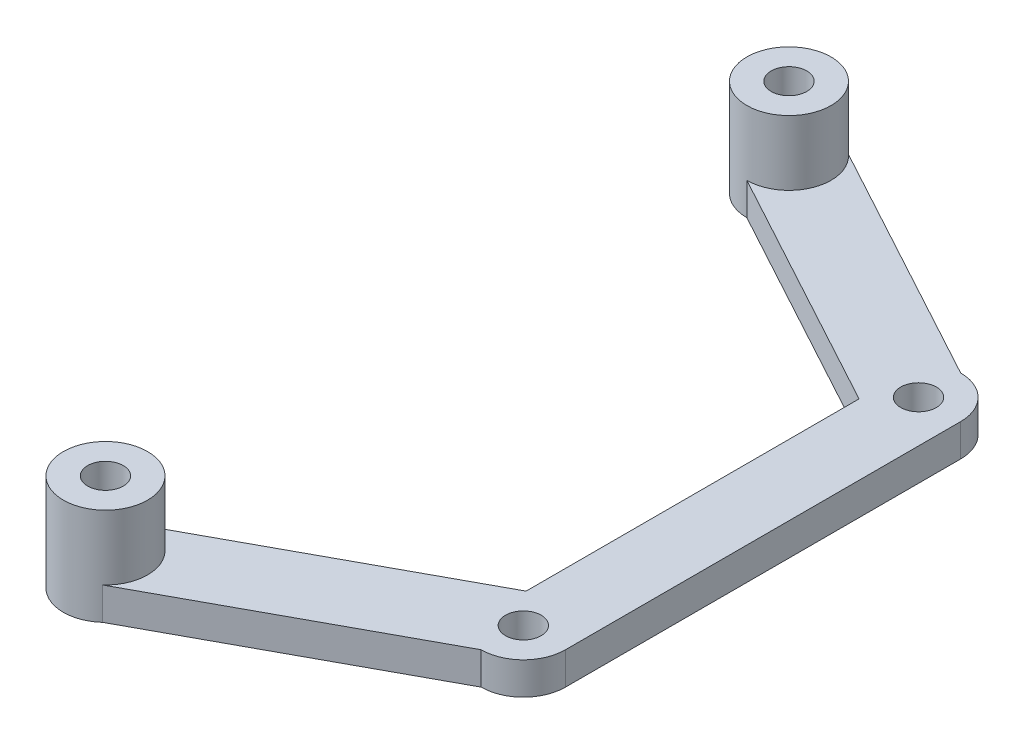
from build123d import *

# Parameters (mm, degrees)
SKETCH3_R           = 1.375
BOSS_EXTRUDE1_DEPTH = 2.5
SKETCH4_R           = 3.25
SKETCH4_R_2         = 1.375
BOSS_EXTRUDE2_DEPTH = 5


with BuildPart() as part:
    # Sketch3 → Boss-Extrude1 (new body)
    with BuildSketch(Plane(origin=(0, 0, 0), x_dir=(1, 0, 0), z_dir=(0, 1, 0))):
        with BuildLine():
            Line((-36.375, 23.125), (-17.438727612, 12.847507244))
            Line((-17.438727612, 12.847507244), (-17.438727612, -12.847507244))
            Line((-17.438727612, -12.847507244), (-36.375, -23.125))
            ThreePointArc((-36.375, -23.125), (-39.405726106, -27.548541338), (-34.186272388, -28.777492756))
            Line((-34.186272388, -28.777492756), (-15.25, -18.5))
            ThreePointArc((-15.25, -18.5), (-12.951902961, -17.548097039), (-12, -15.25))
            Line((-12, -15.25), (-12, 15.25))
            ThreePointArc((-12, 15.25), (-12.951902961, 17.548097039), (-15.25, 18.5))
            Line((-15.25, 18.5), (-34.186272388, 28.777492756))
            ThreePointArc((-34.186272388, 28.777492756), (-39.405726106, 27.548541338), (-36.375, 23.125))
        make_face()
        with Locations((-36.375, 26.375)):
            Circle(SKETCH3_R, mode=Mode.SUBTRACT)
        with Locations((-15.25, 15.25)):
            Circle(SKETCH3_R, mode=Mode.SUBTRACT)
        with Locations((-15.25, -15.25)):
            Circle(SKETCH3_R, mode=Mode.SUBTRACT)
        with Locations((-36.375, -26.375)):
            Circle(SKETCH3_R, mode=Mode.SUBTRACT)
    extrude(amount=BOSS_EXTRUDE1_DEPTH)

    # Sketch4 → Boss-Extrude2 (add)
    # profile 1 of 2: a face of its own
    with BuildSketch(Plane(origin=(0, 2.5, 0), x_dir=(1, 0, 0), z_dir=(0, 1, 0))):
        with Locations((-36.375, 26.375)):
            Circle(SKETCH4_R)
        with Locations((-36.375, 26.375)):
            Circle(SKETCH4_R_2, mode=Mode.SUBTRACT)
    # profile 2 of 2: a face of its own
    with BuildSketch(Plane(origin=(0, 2.5, 0), x_dir=(1, 0, 0), z_dir=(0, 1, 0))):
        with Locations((-36.375, -26.375)):
            Circle(SKETCH4_R)
        with Locations((-36.375, -26.375)):
            Circle(SKETCH4_R_2, mode=Mode.SUBTRACT)
    extrude(amount=BOSS_EXTRUDE2_DEPTH)


solid = part.part
